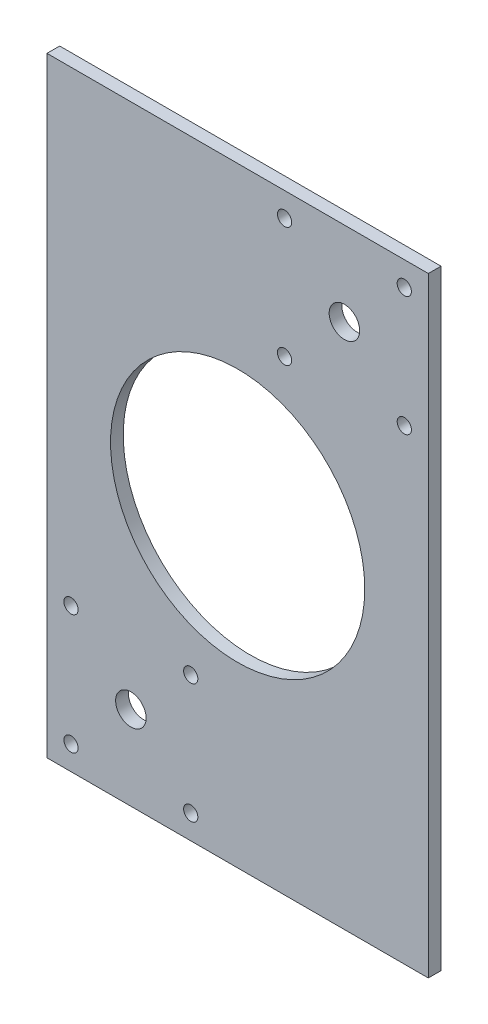
from build123d import *

# Parameters (mm, degrees)
SKETCH1_W               = 150
SKETCH1_H               = 240
BOSS_EXTRUDE1_DEPTH     = 5
SKETCH7_R               = 2.8
SKETCH7_R_2             = 6
CUT_EXTRUDE4_DEPTH      = 142.598022585
SKETCH8_R               = 50
CUT_EXTRUDE5_DEPTH      = 142.598022585
DELETEFACE1_OUTLINE_R   = 6
DELETEFACE1_OUTLINE_R_2 = 2.8
DELETEFACE1_DEPTH       = 5


# Read off the part's stored shape, not the designer's step: DeleteFace1
with BuildPart() as part:
    # Sketch1 → Boss-Extrude1 (new body)
    with BuildSketch(Plane.XY):
        Rectangle(SKETCH1_W, SKETCH1_H)
    extrude(amount=BOSS_EXTRUDE1_DEPTH)

    # Sketch7 → Cut-Extrude4 (cut, through all)
    with BuildSketch(Plane.XY.offset(5)):
        with Locations((-65.55, -110.55)):
            Circle(SKETCH7_R)
        with Locations((-65.55, -63.45)):
            Circle(SKETCH7_R)
        with Locations((-18.45, -63.45)):
            Circle(SKETCH7_R)
        with Locations((-18.45, -110.55)):
            Circle(SKETCH7_R)
        with Locations(Location((-18.45, 110.55, 0), (0, 0, 180))):
            Circle(SKETCH7_R)
        with Locations(Location((-18.45, 63.45, 0), (0, 0, 180))):
            Circle(SKETCH7_R)
        with Locations(Location((-65.55, 63.45, 0), (0, 0, 180))):
            Circle(SKETCH7_R)
        with Locations(Location((-65.55, 110.55, 0), (0, 0, 180))):
            Circle(SKETCH7_R)
        with Locations((65.55, 110.55)):
            Circle(SKETCH7_R)
        with Locations((65.55, 63.45)):
            Circle(SKETCH7_R)
        with Locations((18.45, 63.45)):
            Circle(SKETCH7_R)
        with Locations((18.45, 110.55)):
            Circle(SKETCH7_R)
        with Locations(Location((18.45, -110.55, 0), (0, 0, 180))):
            Circle(SKETCH7_R)
        with Locations(Location((18.45, -63.45, 0), (0, 0, 180))):
            Circle(SKETCH7_R)
        with Locations(Location((65.55, -63.45, 0), (0, 0, 180))):
            Circle(SKETCH7_R)
        with Locations(Location((65.55, -110.55, 0), (0, 0, 180))):
            Circle(SKETCH7_R)
        with Locations((-42, -87)):
            Circle(SKETCH7_R_2)
        with Locations(Location((-42, 87, 0), (0, 0, 180))):
            Circle(SKETCH7_R_2)
        with Locations((42, 87)):
            Circle(SKETCH7_R_2)
        with Locations(Location((42, -87, 0), (0, 0, 180))):
            Circle(SKETCH7_R_2)
    extrude(amount=-CUT_EXTRUDE4_DEPTH, mode=Mode.SUBTRACT)

    # Sketch8 → Cut-Extrude5 (cut, through all)
    with BuildSketch(Plane.XY.offset(5)):
        Circle(SKETCH8_R)
    extrude(amount=-CUT_EXTRUDE5_DEPTH, mode=Mode.SUBTRACT)

    # DeleteFace1 outline → DeleteFace1 (add)
    with BuildSketch(Plane.XY):
        with Locations((42, -87)):
            Circle(DELETEFACE1_OUTLINE_R)
        with Locations((-42, 87)):
            Circle(DELETEFACE1_OUTLINE_R)
        with Locations((-65.55, 110.55)):
            Circle(DELETEFACE1_OUTLINE_R_2)
        with Locations((-65.55, 63.45)):
            Circle(DELETEFACE1_OUTLINE_R_2)
        with Locations((-18.45, 63.45)):
            Circle(DELETEFACE1_OUTLINE_R_2)
        with Locations((-18.45, 110.55)):
            Circle(DELETEFACE1_OUTLINE_R_2)
        with Locations((65.55, -110.55)):
            Circle(DELETEFACE1_OUTLINE_R_2)
        with Locations((65.55, -63.45)):
            Circle(DELETEFACE1_OUTLINE_R_2)
        with Locations((18.45, -63.45)):
            Circle(DELETEFACE1_OUTLINE_R_2)
        with Locations((18.45, -110.55)):
            Circle(DELETEFACE1_OUTLINE_R_2)
    extrude(amount=DELETEFACE1_DEPTH)


solid = part.part
